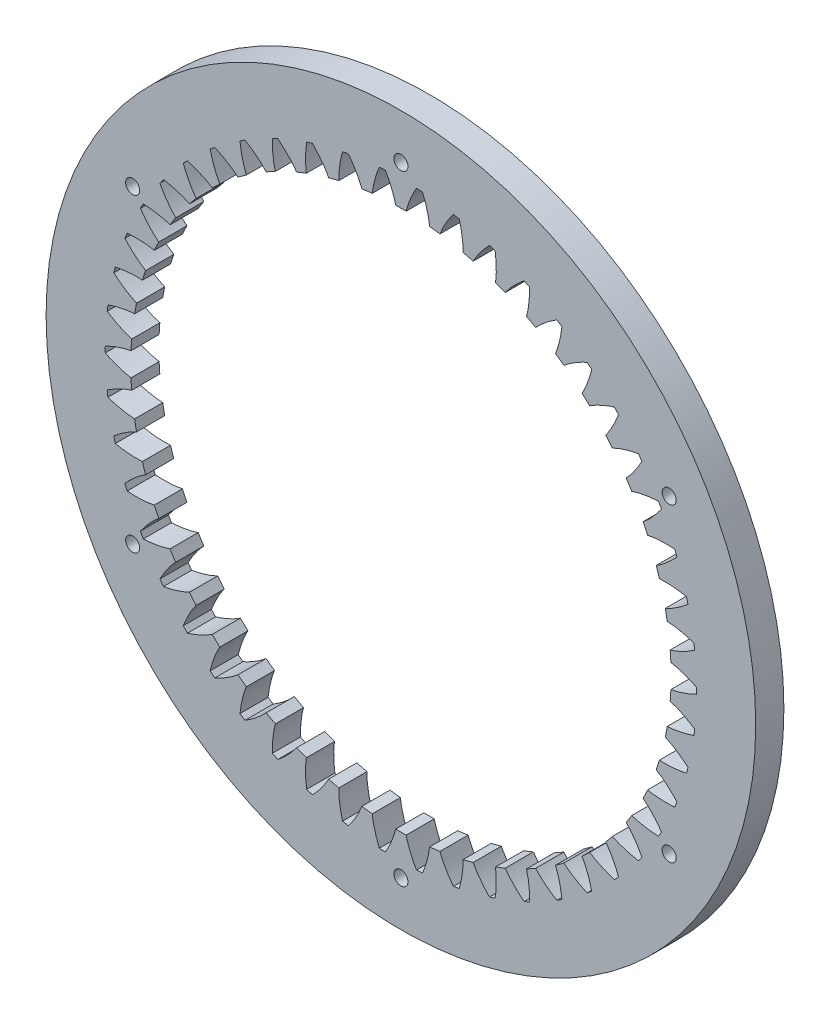
from build123d import *

# Parameters (mm, degrees)
SKETCH_1_R               = 57.000000007
SKETCH_1_R_2             = 52.5
EXTRUDE_1_DEPTH          = 5
EXTRUDE_2_DEPTH          = 5
PATTERN_CIRCULAR_1_COUNT = 50
EXTRUDE_START            = -5
SKETCH_4_R               = 63
SKETCH_4_R_2             = 57.000000007
EXTRUDE_3_DEPTH          = 5
CUT_EXTRUDE_1_REACH      = 91.236
SKETCH_5_R               = 1.25


with BuildPart() as part:
    # 草图1 → 凸台-拉伸1 (new body)
    with BuildSketch(Plane.XY):
        Circle(SKETCH_1_R)
        Circle(SKETCH_1_R_2, mode=Mode.SUBTRACT)
    extrude(amount=EXTRUDE_1_DEPTH)

    # 草图2 → 凸台-拉伸2 (add)
    with BuildSketch(Plane.XY):
        with BuildLine():
            ThreePointArc((0.928459963, 47.962691744), (0, 47.971677449), (-0.928459963, 47.962691744))
            add(Edge.make_bspline(
                [(-0.928459963, 47.962691744), (-0.95972961, 48.100811034), (-1.013379688, 48.316082095), (-1.096488071, 48.612967205), (-1.17139561, 48.861333102), (-1.257034112, 49.126035446), (-1.354085191, 49.406737192), (-1.463220413, 49.703080647), (-1.585101675, 50.014687699), (-1.72038038, 50.341160071), (-1.86969698, 50.682079595), (-2.033680407, 51.037008492), (-2.21294761, 51.405489664), (-2.408102788, 51.787047011), (-2.696210418, 52.323604425), (-2.929234451, 52.727427658), (-3.092917287, 52.998921389)],
                knots=[0, 0, 0, 0, 0.077192464, 0.120910932, 0.168044224, 0.21859234, 0.27255528, 0.329933044, 0.390725632, 0.454933044, 0.52255528, 0.59359234, 0.668044224, 0.745910932, 0.827192464, 1, 1, 1, 1], degree=3))
            ThreePointArc((-3.092917287, 52.998921389), (0, 53.089093095), (3.092917287, 52.998921389))
            add(Edge.make_bspline(
                [(0.928459963, 47.962691744), (0.95972961, 48.100811034), (1.013379688, 48.316082095), (1.096488071, 48.612967205), (1.17139561, 48.861333102), (1.257034112, 49.126035446), (1.354085191, 49.406737192), (1.463220413, 49.703080647), (1.585101675, 50.014687699), (1.72038038, 50.341160071), (1.86969698, 50.682079595), (2.033680407, 51.037008492), (2.21294761, 51.405489664), (2.408102788, 51.787047011), (2.696210418, 52.323604425), (2.929234451, 52.727427658), (3.092917287, 52.998921389)],
                knots=[0, 0, 0, 0, 0.077192464, 0.120910932, 0.168044224, 0.21859234, 0.27255528, 0.329933044, 0.390725632, 0.454933044, 0.52255528, 0.59359234, 0.668044224, 0.745910932, 0.827192464, 1, 1, 1, 1], degree=3))
        make_face()
    extrude_2 = extrude(amount=EXTRUDE_2_DEPTH)

    # 阵列(圆周)1: 凸台-拉伸2 ×50 about axis
    pattern_circular_1_axis = Axis((0, 0, -0.25), (0, 0, 1))
    for i in range(1, PATTERN_CIRCULAR_1_COUNT):
        add(extrude_2.rotate(pattern_circular_1_axis, i * 360 / PATTERN_CIRCULAR_1_COUNT))

    # 草图4 → 凸台-拉伸3 (add)
    with BuildSketch(Plane.XY.offset(5).offset(EXTRUDE_START)):
        Circle(SKETCH_4_R)
        Circle(SKETCH_4_R_2, mode=Mode.SUBTRACT)
    extrude(amount=EXTRUDE_3_DEPTH)

    # 草图5 → 切除-拉伸1 (cut, up to next)
    with BuildSketch(Plane.XY.offset(5), mode=Mode.PRIVATE) as cut_extrude_1_sk1:
        with Locations((0, 55)):
            Circle(SKETCH_5_R)
    cut_extrude_1_tool1 = extrude(cut_extrude_1_sk1.sketch, amount=-CUT_EXTRUDE_1_REACH, mode=Mode.PRIVATE) & part.part
    # 草图5 → 切除-拉伸1 (cut, up to next)
    with BuildSketch(Plane.XY.offset(5), mode=Mode.PRIVATE) as cut_extrude_1_sk2:
        with Locations((47.631397208, 27.5)):
            Circle(SKETCH_5_R)
    cut_extrude_1_tool2 = extrude(cut_extrude_1_sk2.sketch, amount=-CUT_EXTRUDE_1_REACH, mode=Mode.PRIVATE) & part.part
    # 草图5 → 切除-拉伸1 (cut, up to next)
    with BuildSketch(Plane.XY.offset(5), mode=Mode.PRIVATE) as cut_extrude_1_sk3:
        with Locations((47.631397208, -27.5)):
            Circle(SKETCH_5_R)
    cut_extrude_1_tool3 = extrude(cut_extrude_1_sk3.sketch, amount=-CUT_EXTRUDE_1_REACH, mode=Mode.PRIVATE) & part.part
    # 草图5 → 切除-拉伸1 (cut, up to next)
    with BuildSketch(Plane.XY.offset(5), mode=Mode.PRIVATE) as cut_extrude_1_sk4:
        with Locations((0, -55)):
            Circle(SKETCH_5_R)
    cut_extrude_1_tool4 = extrude(cut_extrude_1_sk4.sketch, amount=-CUT_EXTRUDE_1_REACH, mode=Mode.PRIVATE) & part.part
    # 草图5 → 切除-拉伸1 (cut, up to next)
    with BuildSketch(Plane.XY.offset(5), mode=Mode.PRIVATE) as cut_extrude_1_sk5:
        with Locations((-47.631397208, -27.5)):
            Circle(SKETCH_5_R)
    cut_extrude_1_tool5 = extrude(cut_extrude_1_sk5.sketch, amount=-CUT_EXTRUDE_1_REACH, mode=Mode.PRIVATE) & part.part
    # 草图5 → 切除-拉伸1 (cut, up to next)
    with BuildSketch(Plane.XY.offset(5), mode=Mode.PRIVATE) as cut_extrude_1_sk6:
        with Locations((-47.631397208, 27.5)):
            Circle(SKETCH_5_R)
    cut_extrude_1_tool6 = extrude(cut_extrude_1_sk6.sketch, amount=-CUT_EXTRUDE_1_REACH, mode=Mode.PRIVATE) & part.part
    add(cut_extrude_1_tool1.solids().sort_by_distance((0, 55, 5))[0], mode=Mode.SUBTRACT)
    add(cut_extrude_1_tool2.solids().sort_by_distance((47.631397, 27.5, 5))[0], mode=Mode.SUBTRACT)
    add(cut_extrude_1_tool3.solids().sort_by_distance((47.631397, -27.5, 5))[0], mode=Mode.SUBTRACT)
    add(cut_extrude_1_tool4.solids().sort_by_distance((0, -55, 5))[0], mode=Mode.SUBTRACT)
    add(cut_extrude_1_tool5.solids().sort_by_distance((-47.631397, -27.5, 5))[0], mode=Mode.SUBTRACT)
    add(cut_extrude_1_tool6.solids().sort_by_distance((-47.631397, 27.5, 5))[0], mode=Mode.SUBTRACT)


solid = part.part
